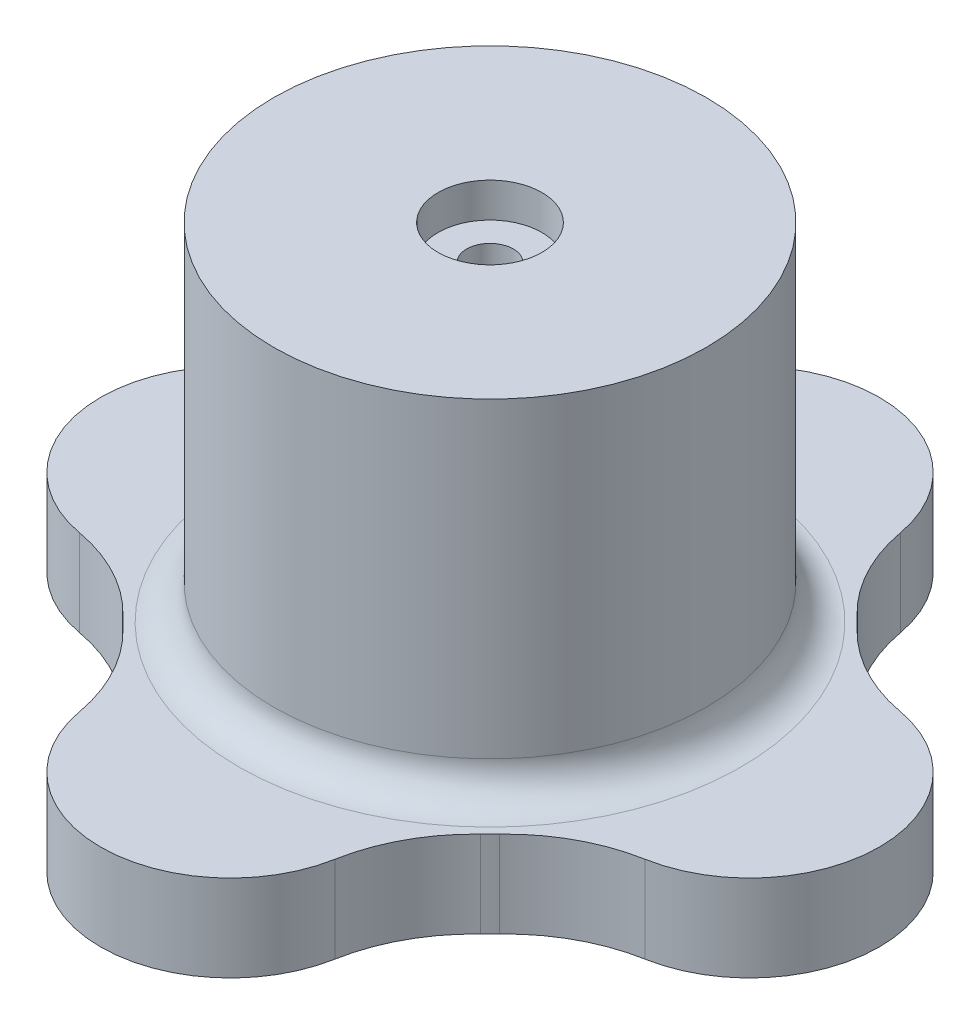
from build123d import *

# Parameters (mm, degrees)
BOSS_EXTRUDE1_DEPTH = 5
FILLET1_R           = 10
SKETCH3_R           = 12.5
BOSS_EXTRUDE2_DEPTH = 20
SKETCH4_R           = 1.35
CUT_EXTRUDE1_DEPTH  = 20
SKETCH5_R           = 3
CUT_EXTRUDE2_DEPTH  = 2
FILLET3_R           = 2


with BuildPart() as part:
    # Sketch2 → Boss-Extrude1 (new body)
    with BuildSketch(Plane(origin=(0, 0, 0), x_dir=(1, 0, 0), z_dir=(0, 1, 0))):
        with BuildLine():
            ThreePointArc((-13.125, -7.261843774), (-10.606601718, -10.606601718), (-7.261843774, -13.125))
            ThreePointArc((-7.261843774, -13.125), (0, -22.5), (7.261843774, -13.125))
            ThreePointArc((7.261843774, -13.125), (10.606601718, -10.606601718), (13.125, -7.261843774))
            ThreePointArc((13.125, -7.261843774), (22.5, 0), (13.125, 7.261843774))
            ThreePointArc((13.125, 7.261843774), (10.606601718, 10.606601718), (7.261843774, 13.125))
            ThreePointArc((7.261843774, 13.125), (0, 22.5), (-7.261843774, 13.125))
            ThreePointArc((-7.261843774, 13.125), (-10.606601718, 10.606601718), (-13.125, 7.261843774))
            ThreePointArc((-13.125, 7.261843774), (-22.5, 0), (-13.125, -7.261843774))
        make_face()
    extrude(amount=BOSS_EXTRUDE1_DEPTH)

    # Fillet1
    fillet1_edges = [part.edges().sort_by_distance(p)[0] for p in [
        (7.261843774, 2.5, -13.125),
        (13.125, 2.5, -7.261843774),
        (7.261843774, 2.5, 13.125),
        (13.125, 2.5, 7.261843774),
        (-7.261843774, 2.5, -13.125),
        (-13.125, 2.5, -7.261843774),
        (-7.261843774, 2.5, 13.125),
        (-13.125, 2.5, 7.261843774),
    ]]
    fillet(fillet1_edges, radius=FILLET1_R)

    # Sketch3 → Boss-Extrude2 (add)
    with BuildSketch(Plane(origin=(0, 5, 0), x_dir=(1, 0, 0), z_dir=(0, 1, 0))):
        Circle(SKETCH3_R)
    extrude(amount=BOSS_EXTRUDE2_DEPTH)

    # Sketch4 → Cut-Extrude1 (cut)
    with BuildSketch(Plane(origin=(0, 25, 0), x_dir=(1, 0, 0), z_dir=(0, 1, 0))):
        Circle(SKETCH4_R)
    extrude(amount=-CUT_EXTRUDE1_DEPTH, mode=Mode.SUBTRACT)

    # Sketch5 → Cut-Extrude2 (cut)
    with BuildSketch(Plane(origin=(0, 25, 0), x_dir=(1, 0, 0), z_dir=(0, 1, 0))):
        Circle(SKETCH5_R)
    extrude(amount=-CUT_EXTRUDE2_DEPTH, mode=Mode.SUBTRACT)

    # Fillet3
    fillet3_edges = [part.edges().sort_by_distance(p)[0] for p in [
        (-12.5, 5, 0),
    ]]
    fillet(fillet3_edges, radius=FILLET3_R)


solid = part.part
